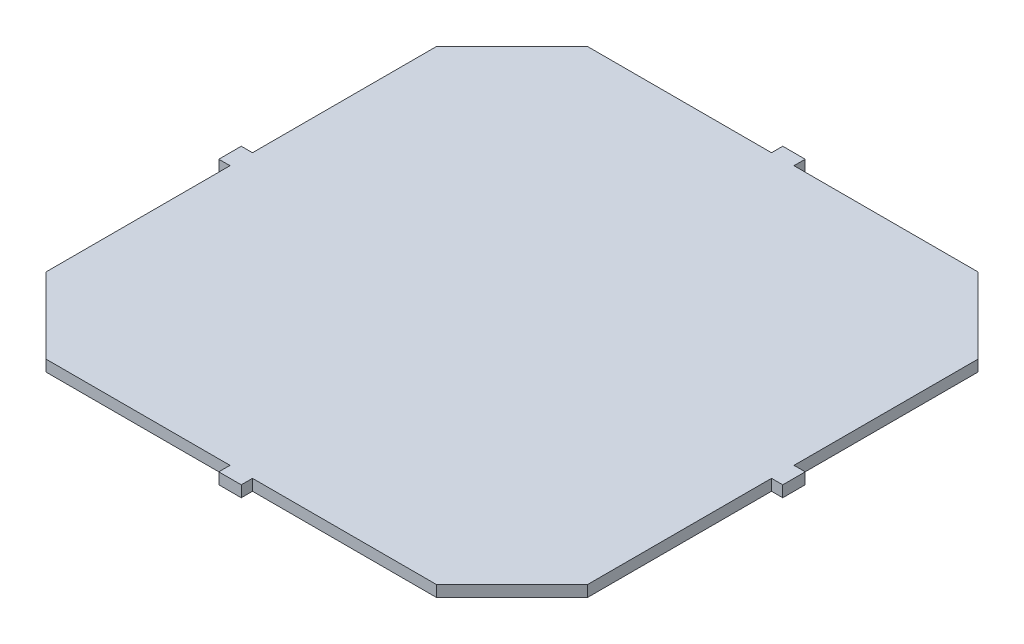
from build123d import *

# Parameters (mm, degrees)
BOSS_EXTRUDE1_DEPTH = 1
SKETCH2_W           = 1
SKETCH2_H           = 2
SKETCH2_W_2         = 2
SKETCH2_H_2         = 1
BOSS_EXTRUDE2_DEPTH = 1


with BuildPart() as part:
    # Sketch1 → Boss-Extrude1 (new body)
    with BuildSketch(Plane(origin=(0, 0, 0), x_dir=(1, 0, 0), z_dir=(0, 1, 0))):
        Polygon((-24.092514421, 17.375), (-17.375, 24.092514421), (17.375, 24.092514421), (24.092514421, 17.375), (24.092514421, -17.375), (17.375, -24.092514421), (-17.375, -24.092514421), (-24.092514421, -17.375), align=None)
    extrude(amount=BOSS_EXTRUDE1_DEPTH)

    # Sketch2 → Boss-Extrude2 (add)
    with BuildSketch(Plane(origin=(0, 1, 0), x_dir=(1, 0, 0), z_dir=(0, 1, 0))):
        with Locations((-24.592514421, 0)):
            Rectangle(SKETCH2_W, SKETCH2_H)
        with Locations((0, 24.592514421)):
            Rectangle(SKETCH2_W_2, SKETCH2_H_2)
        with Locations((0, -24.592514421)):
            Rectangle(SKETCH2_W_2, SKETCH2_H_2)
        with Locations((24.592514421, 0)):
            Rectangle(SKETCH2_W, SKETCH2_H)
    extrude(amount=-BOSS_EXTRUDE2_DEPTH)


solid = part.part
